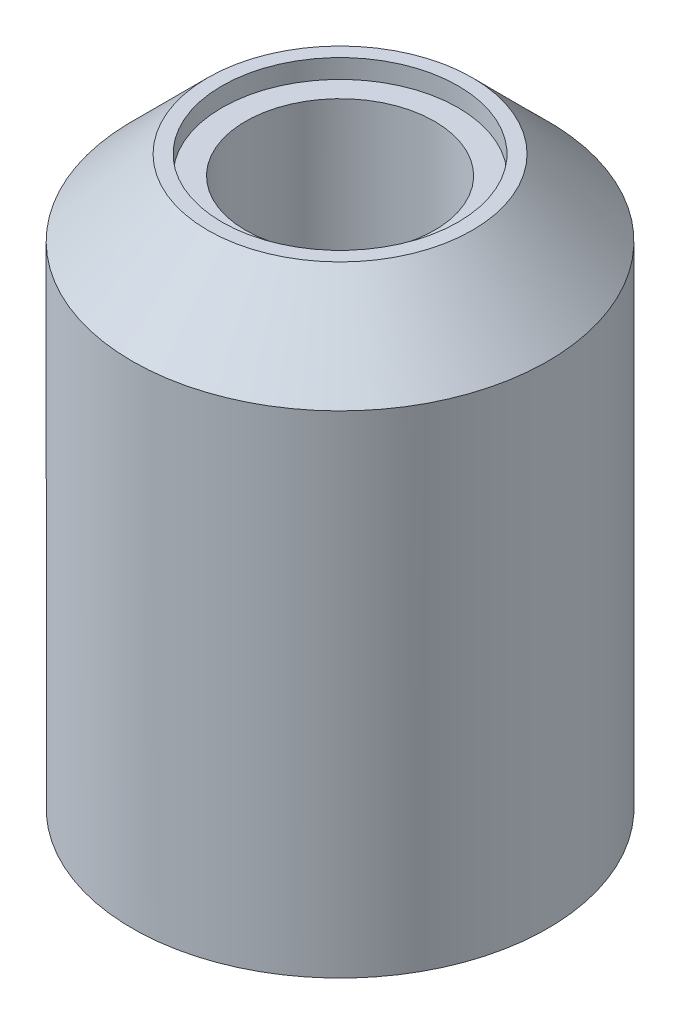
from build123d import *

# Parameters (mm, degrees)
SKETCH2_R                           = 13.97
BOSS_EXTRUDE1_DEPTH                 = 38.1
CHAMFER1_SIZE                       = 5.08
SKETCH5_R                           = 7.9375
CUT_EXTRUDE2_DEPTH                  = 1.27
SKETCH8_W                           = 3.81
SKETCH8_H                           = 23.495
CUT_EXTRUDE4_DEPTH                  = 12.7
SKETCH9_W                           = 12.7
SKETCH9_H                           = 0.508
CUT_EXTRUDE5_DEPTH                  = 9.525
F_1_2_0_5_DIAMETER_HOLE1_D          = 12.7
F_1_4_0_25_DIAMETER_HOLE1_REACH     = 49.213
F_1_4_0_25_DIAMETER_HOLE1_BORE_R    = 3.175
B_0_238_DIAMETER_HOLE1_D            = 6.0452
B_0_238_DIAMETER_HOLE1_DEPTH        = 3.81
B_0_238_DIAMETER_HOLE1_TIP          = 1.816161307
F_1_16_0_0625_DIAMETER_HOLE1_REACH  = 49.213
F_1_16_0_0625_DIAMETER_HOLE1_BORE_R = 0.79375
CUT_EXTRUDE6_START                  = -1.27
SKETCH21_R                          = 7.9375
CUT_EXTRUDE6_DEPTH                  = 1.27
F_8_32_TAPPED_HOLE1_D               = 3.4544
F_8_32_TAPPED_HOLE1_DEPTH           = 6.35
F_8_32_TAPPED_HOLE1_CSINK_D         = 4.318
F_8_32_TAPPED_HOLE1_CSINK_ANGLE     = 90
F_8_32_TAPPED_HOLE1_TIP             = 1.037806461


# Read off the part's stored shape, not the designer's step: M2.5x0.45 Tapped Hole1
with BuildPart() as part:
    # Sketch2 → Boss-Extrude1 (new body)
    with BuildSketch(Plane(origin=(0, 0, 0), x_dir=(1, 0, 0), z_dir=(0, 1, 0))):
        with Locations(Location((0, 0, 0), (0, 0, 90))):
            Circle(SKETCH2_R)
    extrude(amount=BOSS_EXTRUDE1_DEPTH)

    # Chamfer1
    chamfer1_edges = [part.edges().sort_by_distance(p)[0] for p in [
        (0, 38.1, 13.97),
    ]]
    chamfer(chamfer1_edges, length=CHAMFER1_SIZE)

    # Sketch5 → Cut-Extrude2 (cut)
    with BuildSketch(Plane(origin=(0, 38.1, 0), x_dir=(1, 0, 0), z_dir=(0, 1, 0))):
        with Locations(Location((0, 0, 0), (0, 0, 270))):
            Circle(SKETCH5_R)
    extrude(amount=-CUT_EXTRUDE2_DEPTH, mode=Mode.SUBTRACT)

    # Sketch8 → Cut-Extrude4 (cut, symmetric)
    with BuildSketch(Plane(origin=(0, 0, 0), x_dir=(0, 0, -1), z_dir=(1, 0, 0))):
        with Locations((12.065, 19.1135)):
            Rectangle(SKETCH8_W, SKETCH8_H)
    extrude(amount=CUT_EXTRUDE4_DEPTH, both=True, mode=Mode.SUBTRACT)

    # Sketch9 → Cut-Extrude5 (cut, symmetric)
    with BuildSketch(Plane(origin=(0, 0, 0), x_dir=(1, 0, 0), z_dir=(0, 1, 0))):
        with Locations((0, 13.97)):
            Rectangle(SKETCH9_W, SKETCH9_H)
    extrude(amount=CUT_EXTRUDE5_DEPTH, both=True, mode=Mode.SUBTRACT)

    # 1/2 (0.5) Diameter Hole1 (through all)
    with Locations(Plane(origin=(0, 0, 0), x_dir=(-1, 0, 0), z_dir=(0, -1, 0))):
        with Locations((0, 0)):
            Hole(F_1_2_0_5_DIAMETER_HOLE1_D / 2)

    # 1/4 (0.25) Diameter Hole1 bore → 1/4 (0.25) Diameter Hole1 (cut, up to next)
    with BuildSketch(Plane(origin=(0, 0, -10.16), x_dir=(-1, 0, 0), z_dir=(0, 0, -1)), mode=Mode.PRIVATE) as f_1_4_0_25_diameter_hole1_sk1:
        with Locations((0, 19.1135)):
            Circle(F_1_4_0_25_DIAMETER_HOLE1_BORE_R)
    f_1_4_0_25_diameter_hole1_tool1 = extrude(f_1_4_0_25_diameter_hole1_sk1.sketch, amount=-F_1_4_0_25_DIAMETER_HOLE1_REACH, mode=Mode.PRIVATE) & part.part
    add(f_1_4_0_25_diameter_hole1_tool1.solids().sort_by_distance((0, 19.1135, -10.16))[0], mode=Mode.SUBTRACT)

    # B (0.238) Diameter Hole1
    with Locations(Plane(origin=(0, 0, -10.16), x_dir=(-1, 0, 0), z_dir=(0, 0, -1))):
        with Locations((4.939140867, 24.052640867), (4.939140867, 14.174359133), (-4.939140867, 14.174359133), (-4.939140867, 24.052640867)):
            Hole(B_0_238_DIAMETER_HOLE1_D / 2, depth=B_0_238_DIAMETER_HOLE1_DEPTH)
            with Locations((0, 0, -(B_0_238_DIAMETER_HOLE1_DEPTH + B_0_238_DIAMETER_HOLE1_TIP / 2))):  # 118° drill point
                Cone(0, B_0_238_DIAMETER_HOLE1_D / 2, B_0_238_DIAMETER_HOLE1_TIP, mode=Mode.SUBTRACT)

    # 1/16 (0.0625) Diameter Hole1 bore → 1/16 (0.0625) Diameter Hole1 (cut, up to next)
    with BuildSketch(Plane(origin=(0, 0, -10.16), x_dir=(-1, 0, 0), z_dir=(0, 0, -1)), mode=Mode.PRIVATE) as f_1_16_0_0625_diameter_hole1_sk1:
        with Locations((4.939140867, 24.052640867)):
            Circle(F_1_16_0_0625_DIAMETER_HOLE1_BORE_R)
    f_1_16_0_0625_diameter_hole1_tool1 = extrude(f_1_16_0_0625_diameter_hole1_sk1.sketch, amount=-F_1_16_0_0625_DIAMETER_HOLE1_REACH, mode=Mode.PRIVATE) & part.part
    # 1/16 (0.0625) Diameter Hole1 bore → 1/16 (0.0625) Diameter Hole1 (cut, up to next)
    with BuildSketch(Plane(origin=(0, 0, -10.16), x_dir=(-1, 0, 0), z_dir=(0, 0, -1)), mode=Mode.PRIVATE) as f_1_16_0_0625_diameter_hole1_sk2:
        with Locations((4.939140867, 14.174359133)):
            Circle(F_1_16_0_0625_DIAMETER_HOLE1_BORE_R)
    f_1_16_0_0625_diameter_hole1_tool2 = extrude(f_1_16_0_0625_diameter_hole1_sk2.sketch, amount=-F_1_16_0_0625_DIAMETER_HOLE1_REACH, mode=Mode.PRIVATE) & part.part
    # 1/16 (0.0625) Diameter Hole1 bore → 1/16 (0.0625) Diameter Hole1 (cut, up to next)
    with BuildSketch(Plane(origin=(0, 0, -10.16), x_dir=(-1, 0, 0), z_dir=(0, 0, -1)), mode=Mode.PRIVATE) as f_1_16_0_0625_diameter_hole1_sk3:
        with Locations((-4.939140867, 14.174359133)):
            Circle(F_1_16_0_0625_DIAMETER_HOLE1_BORE_R)
    f_1_16_0_0625_diameter_hole1_tool3 = extrude(f_1_16_0_0625_diameter_hole1_sk3.sketch, amount=-F_1_16_0_0625_DIAMETER_HOLE1_REACH, mode=Mode.PRIVATE) & part.part
    # 1/16 (0.0625) Diameter Hole1 bore → 1/16 (0.0625) Diameter Hole1 (cut, up to next)
    with BuildSketch(Plane(origin=(0, 0, -10.16), x_dir=(-1, 0, 0), z_dir=(0, 0, -1)), mode=Mode.PRIVATE) as f_1_16_0_0625_diameter_hole1_sk4:
        with Locations((-4.939140867, 24.052640867)):
            Circle(F_1_16_0_0625_DIAMETER_HOLE1_BORE_R)
    f_1_16_0_0625_diameter_hole1_tool4 = extrude(f_1_16_0_0625_diameter_hole1_sk4.sketch, amount=-F_1_16_0_0625_DIAMETER_HOLE1_REACH, mode=Mode.PRIVATE) & part.part
    add(f_1_16_0_0625_diameter_hole1_tool1.solids().sort_by_distance((-4.939141, 24.052641, -10.16))[0], mode=Mode.SUBTRACT)
    add(f_1_16_0_0625_diameter_hole1_tool2.solids().sort_by_distance((-4.939141, 14.174359, -10.16))[0], mode=Mode.SUBTRACT)
    add(f_1_16_0_0625_diameter_hole1_tool3.solids().sort_by_distance((4.939141, 14.174359, -10.16))[0], mode=Mode.SUBTRACT)
    add(f_1_16_0_0625_diameter_hole1_tool4.solids().sort_by_distance((4.939141, 24.052641, -10.16))[0], mode=Mode.SUBTRACT)

    # Sketch21 → Cut-Extrude6 (cut)
    with BuildSketch(Plane.XZ.offset(CUT_EXTRUDE6_START)):
        with Locations(Location((0, 0, 0), (0, 0, 90))):
            Circle(SKETCH21_R)
    extrude(amount=CUT_EXTRUDE6_DEPTH, mode=Mode.SUBTRACT)

    # #8-32 Tapped Hole1
    with Locations(Plane(origin=(0, 0, -13.716), x_dir=(-1, 0, 0), z_dir=(0, 0, -1))):
        with Locations((0, 3.683)):
            CounterSinkHole(F_8_32_TAPPED_HOLE1_D / 2, F_8_32_TAPPED_HOLE1_CSINK_D / 2, depth=F_8_32_TAPPED_HOLE1_DEPTH, counter_sink_angle=F_8_32_TAPPED_HOLE1_CSINK_ANGLE)
            with Locations((0, 0, -(F_8_32_TAPPED_HOLE1_DEPTH + F_8_32_TAPPED_HOLE1_TIP / 2))):  # 118° drill point
                Cone(0, F_8_32_TAPPED_HOLE1_D / 2, F_8_32_TAPPED_HOLE1_TIP, mode=Mode.SUBTRACT)

    # M2.5x0.45 Tapped Hole1 outline → M2.5x0.45 Tapped Hole1 (revolve, cut)
    with BuildSketch(Plane(origin=(-5.772039513, 0, -7.576884905), x_dir=(1, 0, 0), z_dir=(0, 0, 1))):
        Polygon((1.025, 3.175), (0, 3.790882135), (0, 0), (1.025, 0), align=None)
    revolve(axis=Axis((-5.772039513, 0, -7.576884905), (0, 1, 0)), mode=Mode.SUBTRACT)

    # M2.5x0.45 Tapped Hole1 2 outline → M2.5x0.45 Tapped Hole1 2 (revolve, cut)
    with BuildSketch(Plane(origin=(5.772039513, 0, 7.576884905), x_dir=(1, 0, 0), z_dir=(0, 0, 1))):
        Polygon((1.025, 3.175), (0, 3.790882135), (0, 0), (1.025, 0), align=None)
    revolve(axis=Axis((5.772039513, 0, 7.576884905), (0, 1, 0)), mode=Mode.SUBTRACT)


solid = part.part
